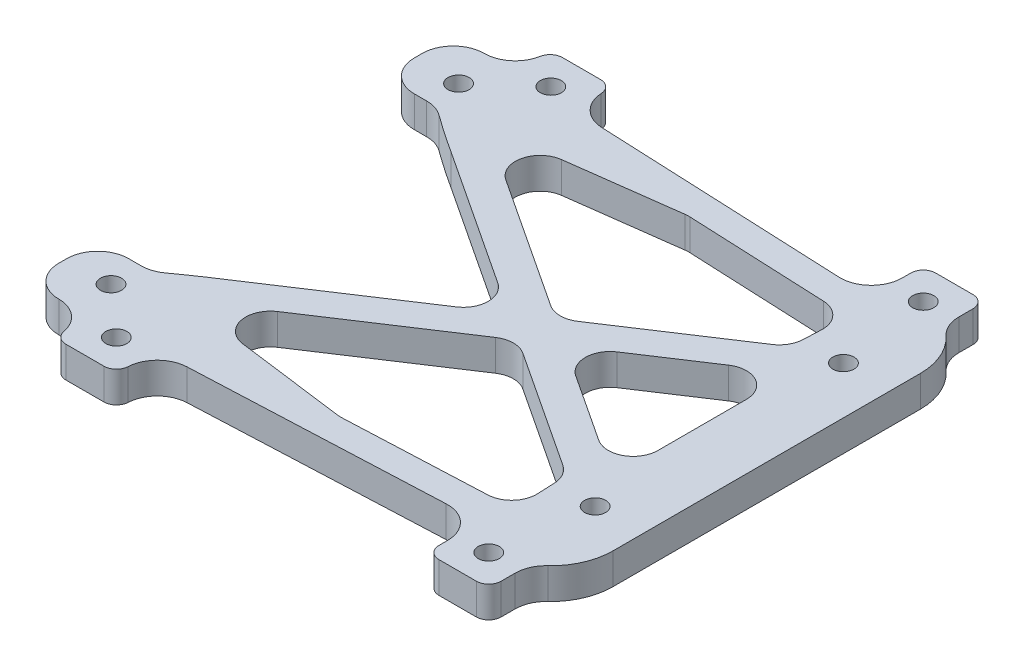
from build123d import *
from OCP.BRepAlgoAPI import BRepAlgoAPI_Cut
from OCP.TopTools import TopTools_ListOfShape
from build123d.topology import SkipClean

# Parameters (mm, degrees)
BOSS_EXTRUDE1_START = -7.303964
SKETCH1_R           = 1.7
BOSS_EXTRUDE1_DEPTH = 5
BOSS_EXTRUDE2_START = -5
BOSS_EXTRUDE2_DEPTH = 10
FILLET1_R           = 10
FILLET2_R           = 5
SKETCH3_R           = 1.7
CUT_EXTRUDE1_DEPTH  = 115.408610769
CUT_EXTRUDE2_START  = -8.799934
SKETCH3_3_W         = 50.432532057
SKETCH3_3_H         = 8
SKETCH3_3_R         = 1.7
CUT_EXTRUDE2_DEPTH  = 4.020873
FILLET3_R           = 4
SKETCH4_W           = 13.412803122
SKETCH4_H           = 1.981813703
CUT_EXTRUDE3_DEPTH  = 116.802458496
FILLET5_R           = 10
BOSS_EXTRUDE3_DEPTH = 5
SKETCH5_3_R         = 1.7
CUT_EXTRUDE4_DEPTH  = 119.258781358
FILLET6_START       = -12.303963631
FILLET6_DEPTH       = 5
FILLET7_R           = 2
CUT_EXTRUDE5_START  = -5
CUT_EXTRUDE5_DEPTH  = 5
FILLET8_R           = 4
CUT_EXTRUDE6_DEPTH  = 119.258781358
FILLET9_R           = 10
SKETCH8_W           = 12
SKETCH8_H           = 46
CUT_EXTRUDE7_DEPTH  = 10
FILLET10_START      = -13
FILLET10_DEPTH      = 7
FILLET10_START_2    = -12.303963631
FILLET10_2_DEPTH    = 5
FILLET12_R          = 125


with BuildPart() as part:
    # Sketch1 → Boss-Extrude1 (new body)
    with BuildSketch(Plane(origin=(0, 0, 0), x_dir=(1, 0, 0), z_dir=(0, 1, 0)).offset(BOSS_EXTRUDE1_START)):
        Polygon((-104.614189207, 47.566098263), (-104.614189207, -21.433901737), (-2.875393248, -16.933901737), (-2.875393248, 43.066098263), align=None)
        with Locations((-27.473844214, 33.066098263)):
            Circle(SKETCH1_R, mode=Mode.SUBTRACT)
        with Locations((-97.473844214, 41.066098263)):
            Circle(SKETCH1_R, mode=Mode.SUBTRACT)
        with Locations((-97.473844214, -14.933901737)):
            Circle(SKETCH1_R, mode=Mode.SUBTRACT)
        with Locations((-27.473844214, -6.933901737)):
            Circle(SKETCH1_R, mode=Mode.SUBTRACT)
    extrude(amount=-BOSS_EXTRUDE1_DEPTH)

    # Sketch2 → Boss-Extrude2 (add)
    with BuildSketch(Plane(origin=(0, -7.303963631, 0), x_dir=(1, 0, 0), z_dir=(0, 1, 0)).offset(BOSS_EXTRUDE2_START)):
        Polygon((-7.675393248, 43.278406653), (-2.875393248, 43.066098263), (-2.875393248, -16.933901737), (-7.675393248, -17.146210127), align=None)
    extrude(amount=-BOSS_EXTRUDE2_DEPTH)

    # Fillet1
    fillet1_edges = [part.edges().sort_by_distance(p)[0] for p in [
        (-7.675393248, -12.303963631, -13.066098263),
    ]]
    fillet(fillet1_edges, radius=FILLET1_R - 0.0001)  # a hair under: the kernel refuses the full size

    # Fillet2
    fillet2_edges = [part.edges().sort_by_distance(p)[0] for p in [
        (-2.875393248, -14.803963816, 16.933901737),
        (-2.875393248, -14.803963816, -43.066098263),
        (-104.614189207, -9.803964, -47.566098263),
        (-104.614189207, -9.803964, 21.433901737),
    ]]
    fillet(fillet2_edges, radius=FILLET2_R)

    # Sketch3 → Cut-Extrude1 (cut, through all)
    with BuildSketch(Plane(origin=(-2.875393248, 0, 0), x_dir=(0, 0, -1), z_dir=(1, 0, 0))):
        with Locations((-8.150167766, -18.303963631)):
            Circle(SKETCH3_R)
        with Locations((-1.078501099, -18.303963631)):
            Circle(SKETCH3_R)
        with Locations((5.993165568, -18.303963631)):
            Circle(SKETCH3_R)
        with Locations((13.064832234, -18.303963631)):
            Circle(SKETCH3_R)
        with Locations((20.136498901, -18.303963631)):
            Circle(SKETCH3_R)
        with Locations((34.279832234, -18.303963631)):
            Circle(SKETCH3_R)
        with Locations((27.208165568, -18.303963631)):
            Circle(SKETCH3_R)
    extrude(amount=-CUT_EXTRUDE1_DEPTH, mode=Mode.SUBTRACT)

    # Sketch3<3> → Cut-Extrude2 (cut)
    with BuildSketch(Plane(origin=(-2.875393248, 0, 0), x_dir=(0, 0, -1), z_dir=(1, 0, 0)).offset(CUT_EXTRUDE2_START)):
        with Locations((13.066098262, -18.303963631)):
            Rectangle(SKETCH3_3_W, SKETCH3_3_H)
        with Locations((-8.150167766, -18.303963631)):
            Circle(SKETCH3_3_R, mode=Mode.SUBTRACT)
        with Locations((-1.078501099, -18.303963631)):
            Circle(SKETCH3_3_R, mode=Mode.SUBTRACT)
        with Locations((5.993165568, -18.303963631)):
            Circle(SKETCH3_3_R, mode=Mode.SUBTRACT)
        with Locations((13.064832234, -18.303963631)):
            Circle(SKETCH3_3_R, mode=Mode.SUBTRACT)
        with Locations((20.136498901, -18.303963631)):
            Circle(SKETCH3_3_R, mode=Mode.SUBTRACT)
        with Locations((27.208165568, -18.303963631)):
            Circle(SKETCH3_3_R, mode=Mode.SUBTRACT)
        with Locations((34.279832234, -18.303963631)):
            Circle(SKETCH3_3_R, mode=Mode.SUBTRACT)
    extrude(amount=CUT_EXTRUDE2_DEPTH, mode=Mode.SUBTRACT)

    # Fillet3
    fillet3_edges = [part.edges().sort_by_distance(p)[0] for p in [
        (-9.664890748, -14.303963631, 12.150167766),
        (-9.664890748, -14.303963631, -38.282364291),
    ]]
    fillet(fillet3_edges, radius=FILLET3_R)

    # Sketch4 → Cut-Extrude3 (cut, through all)
    with BuildSketch(Plane.XZ.offset(22.303963631)):
        with Locations((-10.968991687, 16.597612422)):
            Rectangle(SKETCH4_W, SKETCH4_H)
        with Locations((-10.968991687, -42.729808949)):
            Rectangle(SKETCH4_W, SKETCH4_H)
    extrude(amount=-CUT_EXTRUDE3_DEPTH, mode=Mode.SUBTRACT)

    # Fillet5
    # the kernel refuses this fillet: 10 mm, written as the material it adds along each edge
    with BuildSketch(Plane(origin=(-17.675393248, -27.24315083, -41.738902097), x_dir=(1, 0, 0), z_dir=(0, 1, 0))) as fillet5_piece_1_section:
        with BuildLine():
            CenterArc((5.975674732, 10), FILLET5_R, 233.304121322, 36.695878678)
            Line((0, 1.981813703), (0, 0))
            Line((0, 0), (5.975674732, 0))
        make_face()
    fillet5_piece_1 = extrude(amount=19.93918683, mode=Mode.PRIVATE)
    fillet5_piece_1 = fillet5_piece_1 - Plane(origin=(-17.675293248, -22.303864, -41.738902097), x_dir=(0, 1, 0), z_dir=(0, 0, -1)) * Cylinder(9.9999, 64, mode=Mode.PRIVATE)
    add(fillet5_piece_1)
    with BuildSketch(Plane(origin=(-17.675393248, -27.24315083, 15.606705571), x_dir=(1, 0, 0), z_dir=(0, 1, 0))) as fillet5_piece_2_section:
        with BuildLine():
            CenterArc((5.975674732, -10), FILLET5_R, 90, 36.695878678)
            Line((0, -1.981813703), (0, 0))
            Line((0, 0), (5.975674732, 0))
        make_face()
    fillet5_piece_2 = extrude(amount=19.93918683, mode=Mode.PRIVATE)
    fillet5_piece_2 = fillet5_piece_2 - Plane(origin=(-17.675293248, -22.303864, 15.606705571), x_dir=(0, 1, 0), z_dir=(0, 0, -1)) * Cylinder(9.9999, 64, mode=Mode.PRIVATE)
    add(fillet5_piece_2)

    # Sketch5 → Boss-Extrude3 (add)
    with BuildSketch(Plane(origin=(0, -7.303963631, 0), x_dir=(1, 0, 0), z_dir=(0, 1, 0))):
        with BuildLine():
            Line((-84.614189207, 53.066098263), (-94.614189207, 53.066098263))
            Line((-94.614189207, 53.066098263), (-94.614189207, 47.123789116))
            Line((-94.614189207, 47.123789116), (-90.904900538, 46.959723886))
            ThreePointArc((-90.904900538, 46.959723886), (-90.204015766, 49.660496153), (-87.914189207, 48.066098263))
            ThreePointArc((-87.914189207, 48.066098263), (-88.047411738, 47.406395025), (-88.426199045, 46.850088652))
            Line((-88.426199045, 46.850088652), (-84.614189207, 46.68147997))
            Line((-84.614189207, 46.68147997), (-84.614189207, 53.066098263))
        make_face()
        with BuildLine():
            ThreePointArc((-87.914189207, 48.066098263), (-90.204015766, 49.660496153), (-90.904900538, 46.959723886))
            Line((-90.904900538, 46.959723886), (-88.426199045, 46.850088652))
            ThreePointArc((-88.426199045, 46.850088652), (-88.047411738, 47.406395025), (-87.914189207, 48.066098263))
        make_face()
        with BuildLine():
            Line((-88.426199045, 46.850088652), (-90.904900538, 46.959723886))
            ThreePointArc((-90.904900538, 46.959723886), (-89.689308318, 46.367758745), (-88.426199045, 46.850088652))
        make_face()
        with BuildLine():
            Line((-94.614189207, -26.933901737), (-84.614189207, -26.933901737))
            Line((-84.614189207, -26.933901737), (-84.614189207, -20.549283444))
            Line((-84.614189207, -20.549283444), (-88.426199045, -20.717892126))
            ThreePointArc((-88.426199045, -20.717892126), (-88.047411738, -21.274198499), (-87.914189207, -21.933901737))
            ThreePointArc((-87.914189207, -21.933901737), (-90.204015766, -23.528299627), (-90.904900538, -20.82752736))
            Line((-90.904900538, -20.82752736), (-94.614189207, -20.991592591))
            Line((-94.614189207, -20.991592591), (-94.614189207, -26.933901737))
        make_face()
        with BuildLine():
            ThreePointArc((-87.914189207, -21.933901737), (-88.047411738, -21.274198499), (-88.426199045, -20.717892126))
            Line((-88.426199045, -20.717892126), (-90.904900538, -20.82752736))
            ThreePointArc((-90.904900538, -20.82752736), (-90.204015766, -23.528299627), (-87.914189207, -21.933901737))
        make_face()
        with BuildLine():
            Line((-90.904900538, -20.82752736), (-88.426199045, -20.717892126))
            ThreePointArc((-88.426199045, -20.717892126), (-89.689308318, -20.235562219), (-90.904900538, -20.82752736))
        make_face()
        Polygon((-34.614189207, -18.337737712), (-24.614189207, -17.895428566), (-24.614189207, -26.933901737), (-34.614189207, -26.933901737), align=None)
        Polygon((-24.614189207, 44.027625091), (-24.614189207, 53.066098263), (-34.614189207, 53.066098263), (-34.614189207, 44.469934238), align=None)
    extrude(amount=-BOSS_EXTRUDE3_DEPTH)

    # Sketch5<3> → Cut-Extrude4 (cut, through all)
    with BuildSketch(Plane(origin=(0, -7.303963631, 0), x_dir=(1, 0, 0), z_dir=(0, 1, 0))):
        with Locations(Location((-89.614189207, 48.066098263, 0), (0, 0, 180))):
            Circle(SKETCH5_3_R)
        with Locations((-89.614189207, -21.933901737)):
            Circle(SKETCH5_3_R)
        with Locations(Location((-29.614189207, 48.066098263, 0), (0, 0, 180))):
            Circle(SKETCH5_3_R)
        with Locations((-29.614189207, -21.933901737)):
            Circle(SKETCH5_3_R)
    extrude(amount=-CUT_EXTRUDE4_DEPTH, mode=Mode.SUBTRACT)

    # Fillet6: read off the stored shape, not the designer's step
    # Fillet6 outline → Fillet6 (add)
    with BuildSketch(Plane(origin=(0, 0, 0), x_dir=(1, 0, 0), z_dir=(0, 1, 0)).offset(FILLET6_START)):
        with BuildLine():
            Line((-34.614189207, 44.469934238), (-34.614189207, 49.695977356))
            ThreePointArc((-34.614189207, 49.695977356), (-36.157651402, 46.083174234), (-39.835127767, 44.700861126))
            Line((-39.835127767, 44.700861126), (-34.614189207, 44.469934238))
        make_face()
        with BuildLine():
            Line((-84.614189207, 46.68147997), (-79.835127767, 46.470097711))
            ThreePointArc((-79.835127767, 46.470097711), (-83.22699233, 48.008676136), (-84.614189207, 51.465213942))
            Line((-84.614189207, 51.465213942), (-84.614189207, 46.68147997))
        make_face()
        with BuildLine():
            ThreePointArc((-19.835127767, 43.816242833), (-23.22699233, 45.354821257), (-24.614189207, 48.811359063))
            Line((-24.614189207, 48.811359063), (-24.614189207, 44.027625091))
            Line((-24.614189207, 44.027625091), (-19.835127767, 43.816242833))
        make_face()
        with BuildLine():
            ThreePointArc((-84.614189207, -25.333017416), (-83.22699233, -21.87647961), (-79.835127767, -20.337901186))
            Line((-79.835127767, -20.337901186), (-84.614189207, -20.549283444))
            Line((-84.614189207, -20.549283444), (-84.614189207, -25.333017416))
        make_face()
        with BuildLine():
            ThreePointArc((-39.835127767, -18.5686646), (-36.157651402, -19.950977708), (-34.614189207, -23.56378083))
            Line((-34.614189207, -23.56378083), (-34.614189207, -18.337737712))
            Line((-34.614189207, -18.337737712), (-39.835127767, -18.5686646))
        make_face()
        with BuildLine():
            Line((-24.614189207, -17.895428566), (-24.614189207, -22.679162537))
            ThreePointArc((-24.614189207, -22.679162537), (-23.226992329, -19.222624731), (-19.835127767, -17.684046307))
            Line((-19.835127767, -17.684046307), (-24.614189207, -17.895428566))
        make_face()
        with BuildLine():
            ThreePointArc((-94.614189207, 52.340055145), (-96.078655302, 48.80452124), (-99.614189207, 47.340055145))
            ThreePointArc((-99.614189207, 47.340055145), (-99.503692942, 47.338834053), (-99.393250648, 47.335171375))
            Line((-99.393250648, 47.335171375), (-94.614189207, 47.123789116))
            Line((-94.614189207, 47.123789116), (-94.614189207, 52.340055145))
        make_face()
        with BuildLine():
            ThreePointArc((-99.614189207, -21.207858619), (-96.078655301, -22.672324714), (-94.614189207, -26.207858619))
            Line((-94.614189207, -26.207858619), (-94.614189207, -20.991592591))
            Line((-94.614189207, -20.991592591), (-99.393250648, -21.202974849))
            ThreePointArc((-99.393250648, -21.202974849), (-99.503692942, -21.206637527), (-99.614189207, -21.207858619))
        make_face()
    extrude(amount=FILLET6_DEPTH)

    # Fillet7
    # the kernel refuses this fillet: 2 mm, written as the material it takes off along each edge
    with BuildSketch(Plane(origin=(-84.614189207, -2.332432025, 26.933901737), x_dir=(0.004312775009976594, 0, -0.9999906999426111), z_dir=(0, -1, 0))) as fillet7_piece_1:
        with BuildLine():
            CenterArc((1.991404961, -1.997219699), FILLET7_R, 93.021474281, 86.731421147)
            Line((-0.008576439, -1.988594149), (-0.208574579, -1.987731593))
            Line((-0.208574579, -1.987731593), (-0.19999814, 0.000862555))
            Line((-0.19999814, 0.000862555), (0.000862555, 0.19999814))
            ThreePointArc((0.000862555, 0.19999814), (1.601731988, 0.193093887), (1.875442442, 0.19972197))
            Line((1.875442442, 0.19972197), (1.885984489, 0))
        make_face()
    extrude(amount=14.943063214, mode=Mode.SUBTRACT)
    with BuildSketch(Plane(origin=(-94.614189207, -2.596219396, 26.933901737), x_dir=(1, 0, 0), z_dir=(0, -1, 0))) as fillet7_piece_2:
        with BuildLine():
            CenterArc((1.883097694, -2), FILLET7_R, 90, 79.51408304)
            Line((-0.083501647, -1.636012319), (-0.280161581, -1.599613551))
            ThreePointArc((-0.280161581, -1.599613551), (-0.2, -0.726043118), (-0.2, 0))
            Line((-0.2, 0), (0, 0.2))
            Line((0, 0.2), (1.883097694, 0.2))
            Line((1.883097694, 0.2), (1.883097694, 0))
        make_face()
    extrude(amount=14.41548847, mode=Mode.SUBTRACT)
    with BuildSketch(Plane(origin=(-84.614189207, -2.332432025, -53.066098263), x_dir=(-1, 0, 0), z_dir=(0, -1, 0))) as fillet7_piece_3:
        with BuildLine():
            CenterArc((1.988612643, -2), FILLET7_R, 90, 86.73142114)
            Line((-0.008133827, -1.885966949), (-0.207808474, -1.874563644))
            ThreePointArc((-0.207808474, -1.874563644), (-0.2, -1.600884321), (-0.2, 0))
            Line((-0.2, 0), (0, 0.2))
            Line((0, 0.2), (1.988612643, 0.2))
            Line((1.988612643, 0.2), (1.988612643, 0))
        make_face()
    extrude(amount=14.943063213, mode=Mode.SUBTRACT)
    with BuildSketch(Plane(origin=(-94.614189207, -2.596219397, -53.066098263), x_dir=(-0.0509733912520259, 0, 0.9987000117073535), z_dir=(0, -1, 0))) as fillet7_piece_4:
        with BuildLine():
            CenterArc((1.901412148, -1.982596471), FILLET7_R, 97.564090564, 79.514083027)
            Line((-0.095987876, -1.880649689), (-0.295727878, -1.870455011))
            Line((-0.295727878, -1.870455011), (-0.199740002, 0.010194678))
            Line((-0.199740002, 0.010194678), (0.010194678, 0.199740002))
            ThreePointArc((0.010194678, 0.199740002), (0.735293948, 0.162731122), (1.611814858, 0.198259647))
            Line((1.611814858, 0.198259647), (1.638141884, 0))
        make_face()
    extrude(amount=14.415488469, mode=Mode.SUBTRACT)
    with BuildSketch(Plane(origin=(-34.614189207, -2.303963631, -53.066098263), x_dir=(1, 0, 0), z_dir=(0, -1, 0)), Plane(origin=(-24.614189207, -2.303963631, -53.066098263), x_dir=(0, 0, 1), z_dir=(0, -1, 0)), Plane(origin=(-34.614189207, -2.303963631, 26.933901737), x_dir=(0, 0, -1), z_dir=(0, -1, 0))) as fillet7_piece_5:
        with BuildLine():
            CenterArc((FILLET7_R, FILLET7_R), FILLET7_R, 180, 90)
            Line((0, FILLET7_R), (0, 0))
            Line((0, 0), (FILLET7_R, 0))
        make_face()
    extrude(amount=15, mode=Mode.SUBTRACT)
    with BuildSketch(Plane(origin=(-24.614189207, -2.303963631, 26.933901737), x_dir=(0, 0, -1), z_dir=(0, -1, 0))) as fillet7_piece_6:
        with BuildLine():
            CenterArc((FILLET7_R, -FILLET7_R), FILLET7_R, 90, 90)
            Line((0, -FILLET7_R), (0, 0))
            Line((0, 0), (FILLET7_R, 0))
        make_face()
    extrude(amount=15, mode=Mode.SUBTRACT)


with BuildPart() as cut_extrude5_tool:
    # Cut-Extrude5: read off the stored shape, not the designer's step
    # Cut-Extrude5 outline → Cut-Extrude5 (new body)
    with BuildSketch(Plane.XZ.offset(12.303963631).offset(CUT_EXTRUDE5_START)):
        Polygon((-61.421899314, -13.066098263), (-94.723844214, 8.858558904), (-94.723844214, -34.99075543), align=None)
        Polygon((-33.705417369, -39.925338738), (-34.097751043, -31.055215265), (-56.875514756, -16.05925446), (-89.222466664, -37.355182765), (-60.614189207, -41.115538328), align=None)
        Polygon((-89.222466664, 11.222986239), (-56.875514756, -10.072942065), (-34.097751043, 4.923018739), (-33.705417369, 13.793142212), (-60.614189207, 14.983341803), align=None)
        Polygon((-30.223844214, -27.619326858), (-30.223844214, 1.487130332), (-52.329130199, -13.066098263), align=None)
    extrude(amount=CUT_EXTRUDE5_DEPTH)


with BuildPart() as part_1:
    add(part.part)

    # Cut-Extrude5: cut by cut_extrude5_tool, with a tolerance
    cut_extrude5_stock = TopTools_ListOfShape()
    cut_extrude5_stock.Append(part_1.part.wrapped)
    cut_extrude5_tools = TopTools_ListOfShape()
    cut_extrude5_tools.Append(cut_extrude5_tool.part.wrapped)
    cut_extrude5_cut = BRepAlgoAPI_Cut()
    cut_extrude5_cut.SetArguments(cut_extrude5_stock)
    cut_extrude5_cut.SetTools(cut_extrude5_tools)
    cut_extrude5_cut.SetFuzzyValue(0.00001)
    cut_extrude5_cut.Build()
    add(Compound.cast(cut_extrude5_cut.Shape()).solids(), mode=Mode.REPLACE)

    # Fillet8
    fillet8_edges = [part_1.edges().sort_by_distance(p)[0] for p in [
        (-30.223844214, -9.803963631, -27.619326858),
        (-52.329130199, -9.803963631, -13.066098263),
        (-30.223844214, -9.803963631, 1.487130332),
        (-33.705417369, -9.803963631, 13.793142212),
        (-34.097751043, -9.803963631, 4.923018739),
        (-56.875514756, -9.803963631, -10.072942065),
        (-89.222466664, -9.803963631, 11.222986239),
        (-60.614189207, -9.803963631, 14.983341803),
        (-89.222466664, -9.803963631, -37.355182765),
        (-56.875514756, -9.803963631, -16.05925446),
        (-34.097751043, -9.803963631, -31.055215265),
        (-33.705417369, -9.803963631, -39.925338738),
        (-60.614189207, -9.803963631, -41.115538328),
        (-94.723844214, -9.803963631, 8.858558904),
        (-61.421899314, -9.803963631, -13.066098263),
        (-94.723844214, -9.803963631, -34.99075543),
    ]]
    fillet(fillet8_edges, radius=FILLET8_R)

    # Sketch7 → Cut-Extrude6 (cut, through all)
    with SkipClean():  # the faces are left unmerged after this step: merging them gives an invalid solid
        with BuildSketch(Plane(origin=(0, -7.303963631, 0), x_dir=(1, 0, 0), z_dir=(0, 1, 0))):
            Polygon((-19.835127767, 69.740620805), (-19.835127767, 43.816242833), (-19.835127767, -17.684046307), (-19.835127767, -26.647477061), (6.358945615, -26.647477061), (6.358945615, 69.740620805), align=None)
        extrude(amount=-CUT_EXTRUDE6_DEPTH, mode=Mode.SUBTRACT)

    # Fillet9
    fillet9_edges = [part_1.edges().sort_by_distance(p)[0] for p in [
        (-19.835127767, -9.803963815, -43.816242833),
        (-19.835127767, -9.803963816, 17.684046307),
    ]]
    fillet(fillet9_edges, radius=FILLET9_R)

    # Sketch8 → Cut-Extrude7 (cut)
    with SkipClean():  # the faces are left unmerged after this step: merging them gives an invalid solid
        with BuildSketch(Plane(origin=(0, -7.303963631, 0), x_dir=(1, 0, 0), z_dir=(0, 1, 0))):
            with Locations((-98.614189207, 13.066098263)):
                Rectangle(SKETCH8_W, SKETCH8_H)
        extrude(amount=-CUT_EXTRUDE7_DEPTH, mode=Mode.SUBTRACT)

    # Fillet10: read off the stored shape, not the designer's step
    # Fillet10 outline → Fillet10 (cut)
    with SkipClean():  # the faces are left unmerged after this step: merging them gives an invalid solid
        with BuildSketch(Plane(origin=(0, 0, 0), x_dir=(1, 0, 0), z_dir=(0, 1, 0)).offset(FILLET10_START)):
            with BuildLine():
                ThreePointArc((-104.614189207, -14.933901737), (-103.149723113, -11.398367831), (-99.614189207, -9.933901737))
                Line((-99.614189207, -9.933901737), (-104.614189207, -9.933901737))
                Line((-104.614189207, -9.933901737), (-104.614189207, -14.933901737))
            make_face()
            with BuildLine():
                Line((-104.614189207, 36.066098263), (-99.614189207, 36.066098263))
                ThreePointArc((-99.614189207, 36.066098263), (-103.149723113, 37.530564357), (-104.614189207, 41.066098263))
                Line((-104.614189207, 41.066098263), (-104.614189207, 36.066098263))
            make_face()
        extrude(amount=FILLET10_DEPTH, mode=Mode.SUBTRACT)

    # Fillet10 2 outline → Fillet10 2 (add)
    with SkipClean():  # the faces are left unmerged after this step: merging them gives an invalid solid
        with BuildSketch(Plane(origin=(0, 0, 0), x_dir=(1, 0, 0), z_dir=(0, 1, 0)).offset(FILLET10_START_2)):
            with BuildLine():
                Line((-92.614189207, -9.933901737), (-92.614189207, -4.961208042))
                ThreePointArc((-92.614189207, -4.961208042), (-94.088248192, -8.479076735), (-97.614114644, -9.933901737))
                Line((-97.614114644, -9.933901737), (-92.614189207, -9.933901737))
            make_face()
            with BuildLine():
                ThreePointArc((-97.614114644, 36.066098263), (-94.088248192, 34.61127326), (-92.614189207, 31.093404568))
                Line((-92.614189207, 31.093404568), (-92.614189207, 36.066098263))
                Line((-92.614189207, 36.066098263), (-97.614114644, 36.066098263))
            make_face()
        extrude(amount=FILLET10_2_DEPTH)

    # Fillet12
    fillet12_edges = [part_1.edges().sort_by_distance(p)[0] for p in [
        (-92.614189207, -9.803963815, 4.961208043),
        (-92.614189207, -9.803963815, -31.093404569),
    ]]
    fillet(fillet12_edges, radius=FILLET12_R)


solid = part_1.part
